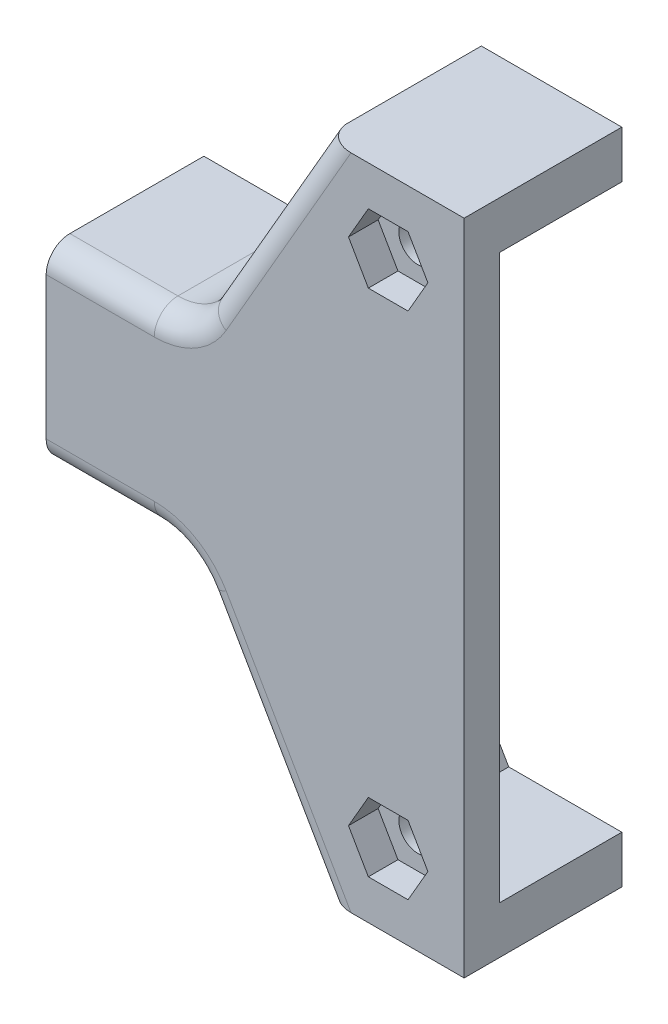
from build123d import *

# Parameters (mm, degrees)
EXTRUDE_1_DEPTH     = 3
EXTRUDE_2_DEPTH     = 10.3
EXTRUDE_3_DEPTH     = 1.8
FILLET_1_R          = 2
CUT_EXTRUDE_1_DEPTH = 2.5
CUT_EXTRUDE_2_REACH = 49.449
SKETCH_7_R          = 1.6
SKETCH_8_R          = 1.6
EXTRUDE_4_DEPTH     = 2.5
CHAMFER_1_SIZE      = 2.5
EXTRUDE_5_DEPTH     = 8


with BuildPart() as part:
    # Эскиз3 → Бобышка-Вытянуть1 (new body)
    with BuildSketch(Plane.XY):
        with BuildLine():
            Line((-35.402667816, -8), (-26.289419162, -8))
            ThreePointArc((-26.289419162, -8), (-23.789419162, -8.669872981), (-21.959292144, -10.5))
            Line((-21.959292144, -10.5), (-12, -27.75))
            Line((-12, -27.75), (-0.15, -27.75))
            Line((-0.15, -27.75), (-0.15, 27.75))
            Line((-0.15, 27.75), (-12, 27.75))
            Line((-12, 27.75), (-21.959292144, 10.5))
            ThreePointArc((-21.959292144, 10.5), (-23.789419162, 8.669872981), (-26.289419162, 8))
            Line((-26.289419162, 8), (-35.402667816, 8))
            Line((-35.402667816, 8), (-35.402667816, -8))
        make_face()
    extrude(amount=-EXTRUDE_1_DEPTH)

    # Эскиз4 → Бобышка-Вытянуть2 (add)
    with BuildSketch(Plane(origin=(0, 0, -3), x_dir=(-1, 0, 0), z_dir=(0, 0, -1))):
        with BuildLine():
            Line((12, -27.75), (0.15, -27.75))
            Line((0.15, -27.75), (0.15, -23.75))
            Line((0.15, -23.75), (9.690598923, -23.75))
            Line((9.690598923, -23.75), (12.609925056, -18.693578815))
            ThreePointArc((12.609925056, -18.693578815), (15.216591048, -16.5), (15.81295303, -13.145771625))
            Line((15.81295303, -13.145771625), (18.495190528, -8.5))
            ThreePointArc((18.495190528, -8.5), (21.789419162, -5.205771366), (26.289419162, -4))
            Line((26.289419162, -4), (35.402667816, -4))
            Line((35.402667816, -4), (35.402667816, -8))
            Line((35.402667816, -8), (26.289419162, -8))
            ThreePointArc((26.289419162, -8), (23.789419162, -8.669872981), (21.959292144, -10.5))
            Line((21.959292144, -10.5), (12, -27.75))
        make_face()
        with BuildLine():
            Line((26.289419162, 8), (35.402667816, 8))
            Line((35.402667816, 8), (35.402667816, 4))
            Line((35.402667816, 4), (26.289419162, 4))
            ThreePointArc((26.289419162, 4), (21.789419162, 5.205771366), (18.495190528, 8.5))
            Line((18.495190528, 8.5), (15.81295303, 13.145771625))
            ThreePointArc((15.81295303, 13.145771625), (15.216591048, 16.5), (12.609925056, 18.693578815))
            Line((12.609925056, 18.693578815), (9.690598923, 23.75))
            Line((9.690598923, 23.75), (0.15, 23.75))
            Line((0.15, 23.75), (0.15, 27.75))
            Line((0.15, 27.75), (12, 27.75))
            Line((12, 27.75), (21.959292144, 10.5))
            ThreePointArc((21.959292144, 10.5), (23.789419162, 8.669872981), (26.289419162, 8))
        make_face()
    extrude(amount=EXTRUDE_2_DEPTH)

    # Эскиз5 → Бобышка-Вытянуть3 (add)
    with BuildSketch(Plane(origin=(0, 0, -13.3), x_dir=(-1, 0, 0), z_dir=(0, 0, -1))):
        with BuildLine():
            Line((18.495190528, -8.5), (16.495190528, -11.964101615))
            Line((16.495190528, -11.964101615), (18.097337525, -12.889101615))
            Line((18.097337525, -12.889101615), (20.097337525, -9.425))
            ThreePointArc((20.097337525, -9.425), (22.714419162, -6.807918363), (26.289419162, -5.85))
            Line((26.289419162, -5.85), (32.402667816, -5.85))
            Line((32.402667816, -5.85), (32.402667816, -4))
            Line((32.402667816, -4), (26.289419162, -4))
            ThreePointArc((26.289419162, -4), (21.789419162, -5.205771366), (18.495190528, -8.5))
        make_face()
        with BuildLine():
            Line((32.402667816, 4), (26.289419162, 4))
            ThreePointArc((26.289419162, 4), (21.789419162, 5.205771366), (18.495190528, 8.5))
            Line((18.495190528, 8.5), (16.495190528, 11.964101615))
            Line((16.495190528, 11.964101615), (18.097337525, 12.889101615))
            Line((18.097337525, 12.889101615), (20.097337525, 9.425))
            ThreePointArc((20.097337525, 9.425), (22.714419162, 6.807918363), (26.289419162, 5.85))
            Line((26.289419162, 5.85), (32.402667816, 5.85))
            Line((32.402667816, 5.85), (32.402667816, 4))
        make_face()
    extrude(amount=EXTRUDE_3_DEPTH)

    # Скругление1
    fillet_1_edges = [part.edges().sort_by_distance(p)[0] for p in [
        (-30.846043489, 8, 0),
        (-23.789419162, 8.669872981, 0),
        (-16.979646072, 19.125, 0),
        (-16.979646072, -19.125, 0),
        (-23.789419162, -8.669872981, 0),
        (-30.846043489, -8, 0),
    ]]
    fillet(fillet_1_edges, radius=FILLET_1_R)

    # Эскиз6 → Вырез-Вытянуть1 (cut)
    with BuildSketch(Plane.XY):
        Polygon((-8.230652791, 24.4), (-9.904968571, 21.5), (-8.230652791, 18.6), (-4.882021229, 18.6), (-3.207705449, 21.5), (-4.882021229, 24.4), align=None)
        Polygon((-4.882021229, -24.4), (-8.230652791, -24.4), (-9.904968571, -21.5), (-8.230652791, -18.6), (-4.882021229, -18.6), (-3.207705449, -21.5), align=None)
    extrude(amount=-CUT_EXTRUDE_1_DEPTH, mode=Mode.SUBTRACT)

    # Эскиз7 → Вырез-Вытянуть2 (cut, up to next)
    with BuildSketch(Plane.XY, mode=Mode.PRIVATE) as cut_extrude_2_sk1:
        with Locations((-6.55633701, 21.5)):
            Circle(SKETCH_7_R)
    cut_extrude_2_tool1 = extrude(cut_extrude_2_sk1.sketch, amount=-CUT_EXTRUDE_2_REACH, mode=Mode.PRIVATE) & part.part
    # Эскиз7 → Вырез-Вытянуть2 (cut, up to next)
    with BuildSketch(Plane.XY, mode=Mode.PRIVATE) as cut_extrude_2_sk2:
        with Locations((-6.55633701, -21.5)):
            Circle(SKETCH_7_R)
    cut_extrude_2_tool2 = extrude(cut_extrude_2_sk2.sketch, amount=-CUT_EXTRUDE_2_REACH, mode=Mode.PRIVATE) & part.part
    add(cut_extrude_2_tool1.solids().sort_by_distance((-6.556337, 21.5, 0))[0], mode=Mode.SUBTRACT)
    add(cut_extrude_2_tool2.solids().sort_by_distance((-6.556337, -21.5, 0))[0], mode=Mode.SUBTRACT)

    # Эскиз8 → Бобышка-Вытянуть4 (add)
    # profile 1 of 2: a face of its own
    with BuildSketch(Plane(origin=(0, 0, -3), x_dir=(-1, 0, 0), z_dir=(0, 0, -1))):
        with BuildLine():
            Line((9.587425923, 19.75), (10.793712962, 21.839350439))
            Line((10.793712962, 21.839350439), (9.690598923, 23.75))
            Line((9.690598923, 23.75), (3.05633701, 23.75))
            Line((3.05633701, 23.75), (3.05633701, 21.5))
            ThreePointArc((3.05633701, 21.5), (5.650470352, 18.119259608), (9.587425923, 19.75))
        make_face()
        with Locations(Location((6.55633701, 21.5, 0), (0, 0, 180))):
            Circle(SKETCH_8_R, mode=Mode.SUBTRACT)
    # profile 2 of 2: a face of its own
    with BuildSketch(Plane(origin=(0, 0, -3), x_dir=(-1, 0, 0), z_dir=(0, 0, -1))):
        with BuildLine():
            Line((3.05633701, -23.75), (3.05633701, -21.5))
            ThreePointArc((3.05633701, -21.5), (5.650470352, -18.119259608), (9.587425923, -19.75))
            Line((9.587425923, -19.75), (10.793712962, -21.839350439))
            Line((10.793712962, -21.839350439), (9.690598923, -23.75))
            Line((9.690598923, -23.75), (3.05633701, -23.75))
        make_face()
        with Locations(Location((6.55633701, -21.5, 0), (0, 0, 180))):
            Circle(SKETCH_8_R, mode=Mode.SUBTRACT)
    extrude(amount=EXTRUDE_4_DEPTH)

    # Фаска1
    chamfer_1_edges = [part.edges().sort_by_distance(p)[0] for p in [
        (-10.190569442, -20.79467522, -3),
        (-3.05633701, -22.625, -3),
        (-5.650470352, -18.119259608, -3),
        (-3.05633701, 22.625, -3),
        (-10.190569442, 20.79467522, -3),
        (-5.650470352, 18.119259608, -3),
    ]]
    chamfer(chamfer_1_edges, length=CHAMFER_1_SIZE - 0.0001)  # a hair under: the kernel refuses the full size

    # Эскиз10 → Бобышка-Вытянуть5 (add)
    with BuildSketch(Plane.ZY.offset(35.402667816)):
        with BuildLine():
            Line((-10.3, 4), (-3, 4))
            Line((-3, 4), (-3, -4))
            Line((-3, -4), (-10.3, -4))
            Line((-10.3, -4), (-10.3, -3.9))
            ThreePointArc((-10.3, -3.9), (-6.4, 0), (-10.3, 3.9))
            Line((-10.3, 3.9), (-10.3, 4))
        make_face()
    extrude(amount=-EXTRUDE_5_DEPTH)


solid = part.part
